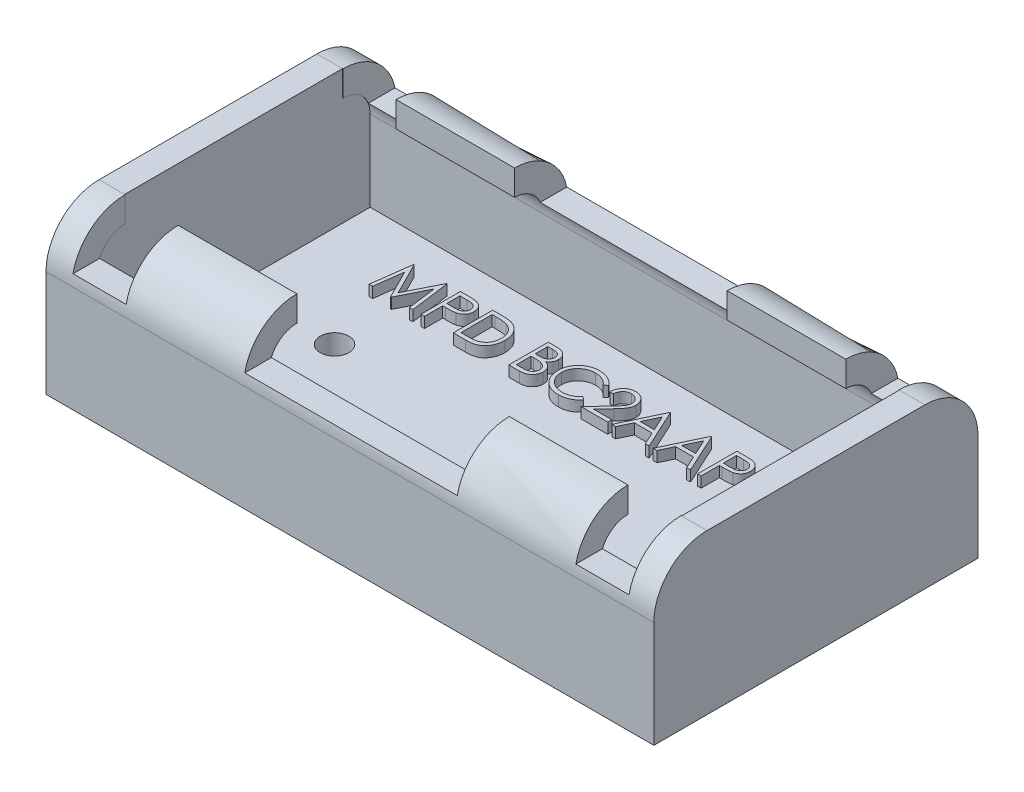
from build123d import *

# Parameters (mm, degrees)
SKETCH1_W           = 57.2
SKETCH1_H           = 30.5
BOSS_EXTRUDE1_DEPTH = 7.5
FILLET5_R           = 5
SHELL6_START        = -26.2
SHELL6_DEPTH        = 52.4
SKETCH2_W           = 5
SKETCH2_H           = 4
SKETCH2_W_2         = 20
CUT_EXTRUDE3_DEPTH  = 43.478935957
SKETCH3_R           = 1.78
SKETCH3_R_2         = 1.35
CUT_EXTRUDE4_DEPTH  = 35.774739395
BOSS_EXTRUDE2_DEPTH = 1
BOSS_EXTRUDE3_DEPTH = 1


# Read off the part's stored shape, not the designer's step: Shell6
with BuildPart() as part:
    # Sketch1 → Boss-Extrude1 (new, symmetric)
    with BuildSketch(Plane(origin=(0, 0, 0), x_dir=(1, 0, 0), z_dir=(0, 1, 0))):
        Rectangle(SKETCH1_W, SKETCH1_H)
    extrude(amount=BOSS_EXTRUDE1_DEPTH, both=True)

    # Fillet5
    fillet5_edges = [part.edges().sort_by_distance(p)[0] for p in [
        (0, 7.5, 15.25),
        (0, 7.5, -15.25),
    ]]
    fillet(fillet5_edges, radius=FILLET5_R)

    # Shell6 outline → Shell6 (cut)
    with BuildSketch(Plane.YZ.offset(SHELL6_START)):
        with BuildLine():
            Line((7.5, -10.25), (7.5, 10.25))
            Line((7.5, 10.25), (5.1, 10.25))
            ThreePointArc((5.1, 10.25), (4.338477631, 12.088477631), (2.5, 12.85))
            Line((2.5, 12.85), (-5.1, 12.85))
            Line((-5.1, 12.85), (-5.1, -12.85))
            Line((-5.1, -12.85), (2.5, -12.85))
            ThreePointArc((2.5, -12.85), (4.338477631, -12.088477631), (5.1, -10.25))
            Line((5.1, -10.25), (7.5, -10.25))
        make_face()
    extrude(amount=SHELL6_DEPTH, mode=Mode.SUBTRACT)

    # Sketch2 → Cut-Extrude3 (cut, through all)
    with BuildSketch(Plane.XY.offset(15.25)):
        with Locations((-23.66, 5.5)):
            Rectangle(SKETCH2_W, SKETCH2_H)
        with Locations((23.66, 5.5)):
            Rectangle(SKETCH2_W, SKETCH2_H)
        with Locations((0, 5.5)):
            Rectangle(SKETCH2_W_2, SKETCH2_H)
    extrude(amount=-CUT_EXTRUDE3_DEPTH, mode=Mode.SUBTRACT)

    # Sketch3 → Cut-Extrude4 (cut, through all)
    with BuildSketch(Plane(origin=(0, -5.1, 0), x_dir=(1, 0, 0), z_dir=(0, 1, 0))):
        with Locations(Location((0, 0, 0), (0, 0, 270))):
            Circle(SKETCH3_R)
        with Locations(Location((16, 0, 0), (0, 0, 270))):
            Circle(SKETCH3_R_2)
        with Locations(Location((-16.7, 0, 0), (0, 0, 270))):
            Circle(SKETCH3_R_2)
    extrude(amount=-CUT_EXTRUDE4_DEPTH, mode=Mode.SUBTRACT)

    # Sketch4 → Boss-Extrude2 (add)
    with BuildSketch(Plane(origin=(0, -5.1, 0), x_dir=(1, 0, 0), z_dir=(0, 1, 0))):
        Polygon((19.403576498, -7.630601638), (19.403576498, -5.75816574), (19.973448293, -5.75816574), (19.973448293, -7.630601638), (21.84588419, -7.630601638), (21.84588419, -8.200473433), (19.973448293, -8.200473433), (19.973448293, -10.07290933), (19.403576498, -10.07290933), (19.403576498, -8.200473433), (17.531140601, -8.200473433), (17.531140601, -7.630601638), align=None)
    extrude(amount=BOSS_EXTRUDE2_DEPTH)

    # Sketch5 → Boss-Extrude3 (add)
    # profile 1 of 10: a face of its own
    with BuildSketch(Plane(origin=(0, -5.1, 0), x_dir=(1, 0, 0), z_dir=(0, 1, 0))):
        Polygon((-18.979934346, 5.52880894), (-18.490942793, 9.232975607), (-18.443453477, 9.232975607), (-16.91414909, 6.193659367), (-15.388554806, 9.232975607), (-15.340323469, 9.232975607), (-14.848363833, 5.52880894), (-15.182273088, 5.52880894), (-15.536958919, 8.194146814), (-16.874079979, 5.52880894), (-16.949024056, 5.52880894), (-18.291339261, 8.200082979), (-18.645283071, 5.52880894), align=None)
    # profile 2 of 10: a face of its own
    with BuildSketch(Plane(origin=(0, -5.1, 0), x_dir=(1, 0, 0), z_dir=(0, 1, 0))):
        with BuildLine():
            Line((-14.088534774, 9.232975607), (-13.362096639, 9.232975607))
            add(Edge.make_bspline(
                [(-13.362096639, 9.232975607), (-13.312131763, 9.232920683), (-13.216396843, 9.232815447), (-13.079115075, 9.229624841), (-12.954433109, 9.225363259), (-12.84261979, 9.219455755), (-12.743331086, 9.212474364), (-12.657016277, 9.202682622), (-12.582996913, 9.192458809), (-12.538645921, 9.182064488), (-12.518419255, 9.177324064)],
                knots=[0, 0, 0, 0, 1.415646017, 2.712440637, 3.8905458, 4.950247383, 5.884950622, 6.709939814, 7.411656543, 8, 8, 8, 8], degree=3))
            add(Edge.make_bspline(
                [(-12.518419255, 9.177324064), (-12.492814432, 9.170315834), (-12.442208131, 9.156464514), (-12.369287861, 9.128721656), (-12.299910041, 9.095826365), (-12.233836641, 9.058336029), (-12.171879604, 9.01464214), (-12.113114543, 8.966515894), (-12.058060064, 8.912846151), (-12.007025758, 8.854234868), (-11.96015768, 8.791665979), (-11.919803766, 8.724205453), (-11.886014118, 8.652988823), (-11.857033489, 8.578065627), (-11.836175374, 8.498806701), (-11.820462406, 8.415762764), (-11.810489066, 8.328942717), (-11.809533855, 8.26961269), (-11.809047594, 8.239410069)],
                knots=[0, 0, 0, 0, 0.999701418, 1.975846123, 2.934577507, 3.890451536, 4.834027766, 5.787354733, 6.749476667, 7.726910423, 8.712836071, 9.690891519, 10.682875813, 11.679750201, 12.712814741, 13.765529915, 14.8625177, 16, 16, 16, 16], degree=3))
            add(Edge.make_bspline(
                [(-11.809047594, 8.239410069), (-11.809493602, 8.208953588), (-11.810366246, 8.149363427), (-11.820839815, 8.06218556), (-11.834947601, 7.978875263), (-11.856640315, 7.899617262), (-11.885051985, 7.824882238), (-11.918381075, 7.753528101), (-11.958580311, 7.686768781), (-12.004771089, 7.624361915), (-12.05615486, 7.566248925), (-12.112514219, 7.512850934), (-12.173621637, 7.464480509), (-12.239282911, 7.421029212), (-12.310138167, 7.383504649), (-12.38511278, 7.349894835), (-12.464858426, 7.321667963), (-12.520042586, 7.306819481), (-12.548100078, 7.299270011)],
                knots=[0, 0, 0, 0, 1.121902311, 2.195077645, 3.232258892, 4.234102512, 5.217864754, 6.176164875, 7.132989551, 8.084763148, 9.034132444, 9.988522005, 10.94243251, 11.903244335, 12.886203696, 13.894208494, 14.929344452, 16, 16, 16, 16], degree=3))
            add(Edge.make_bspline(
                [(-12.548100078, 7.299270011), (-12.571306506, 7.294335023), (-12.622164744, 7.283519709), (-12.705924125, 7.271445759), (-12.803444658, 7.261140131), (-12.914593238, 7.253413094), (-13.039270095, 7.246798121), (-13.177542676, 7.241540222), (-13.329682408, 7.238651126), (-13.435802808, 7.23850212), (-13.491208218, 7.238424325)],
                knots=[0, 0, 0, 0, 0.601384939, 1.31797006, 2.144135048, 3.087295005, 4.142315834, 5.309527816, 6.595305764, 8, 8, 8, 8], degree=3))
            Line((-13.491208218, 7.238424325), (-13.75610956, 7.238424325))
            Line((-13.75610956, 7.238424325), (-13.75610956, 5.52880894))
            Line((-13.75610956, 5.52880894), (-14.088534774, 5.52880894))
            Line((-14.088534774, 5.52880894), (-14.088534774, 9.232975607))
        make_face()
        with BuildLine():
            Line((-13.75610956, 8.853061077), (-13.75610956, 7.618338855))
            Line((-13.75610956, 7.618338855), (-13.107583585, 7.610176628))
            add(Edge.make_bspline(
                [(-13.107583585, 7.610176628), (-13.07591833, 7.610160263), (-13.014789209, 7.610128669), (-12.926485872, 7.614346364), (-12.844561043, 7.619215261), (-12.769266368, 7.626344113), (-12.700567904, 7.636420778), (-12.638351102, 7.6465932), (-12.583098394, 7.661309709), (-12.518435073, 7.681124957), (-12.446380197, 7.714920309), (-12.367992041, 7.763973942), (-12.301559837, 7.826501025), (-12.244072973, 7.896803813), (-12.198452586, 7.975013725), (-12.165055827, 8.058695017), (-12.145433102, 8.146989491), (-12.142801881, 8.207407771), (-12.141472808, 8.237926027)],
                knots=[0, 0, 0, 0, 1.160613943, 2.240541288, 3.23993089, 4.169200891, 5.011653406, 5.7853311, 6.478053781, 7.106038997, 8.262395093, 9.384106736, 10.481365981, 11.59014053, 12.70357646, 13.786202915, 14.881775077, 16, 16, 16, 16], degree=3))
            add(Edge.make_bspline(
                [(-12.141472808, 8.237926027), (-12.142809109, 8.267705954), (-12.145465509, 8.326904763), (-12.165209631, 8.413665618), (-12.198387655, 8.496465072), (-12.244379218, 8.57369492), (-12.300196913, 8.643744738), (-12.365072052, 8.704595864), (-12.43885192, 8.753513833), (-12.507482964, 8.785087389), (-12.568444219, 8.804365222), (-12.62139471, 8.817853512), (-12.681180674, 8.828622695), (-12.747821574, 8.837342835), (-12.82080089, 8.844807749), (-12.900745607, 8.849872908), (-12.987352879, 8.852837782), (-13.0474774, 8.852984843), (-13.078644783, 8.853061077)],
                knots=[0, 0, 0, 0, 1.120700087, 2.227813068, 3.331159281, 4.466773991, 5.599788987, 6.693661531, 7.80175334, 8.91857717, 9.525282508, 10.207424825, 10.974604443, 11.810962634, 12.737642355, 13.736264703, 14.826523623, 16, 16, 16, 16], degree=3))
            Line((-13.078644783, 8.853061077), (-13.75610956, 8.853061077))
        make_face(mode=Mode.SUBTRACT)
    # profile 3 of 10: a face of its own
    with BuildSketch(Plane(origin=(0, -5.1, 0), x_dir=(1, 0, 0), z_dir=(0, 1, 0))):
        with BuildLine():
            Line((-11.049218534, 5.52880894), (-11.049218534, 9.232975607))
            Line((-11.049218534, 9.232975607), (-10.301261803, 9.232975607))
            add(Edge.make_bspline(
                [(-10.301261803, 9.232975607), (-10.236207124, 9.23250722), (-10.110521823, 9.2316023), (-9.928898649, 9.225864661), (-9.7608525, 9.215714751), (-9.606936058, 9.200930336), (-9.466726775, 9.182776709), (-9.340617248, 9.160022114), (-9.227955397, 9.133152967), (-9.158666906, 9.110244866), (-9.125901226, 9.099411905)],
                knots=[0, 0, 0, 0, 1.314313732, 2.53924729, 3.670748893, 4.714932338, 5.66265055, 6.526160246, 7.303039223, 8, 8, 8, 8], degree=3))
            add(Edge.make_bspline(
                [(-9.125901226, 9.099411905), (-9.083044294, 9.083081075), (-8.998302282, 9.050789743), (-8.877644744, 8.989875991), (-8.764058735, 8.920858792), (-8.65693514, 8.84364717), (-8.558720932, 8.756054902), (-8.465579241, 8.661802819), (-8.381320325, 8.557463493), (-8.304159045, 8.445200797), (-8.234588806, 8.326337208), (-8.17411653, 8.201099218), (-8.123894387, 8.07012284), (-8.082203223, 7.933772308), (-8.049345722, 7.791747808), (-8.026928177, 7.643883967), (-8.012142213, 7.490765158), (-8.010656259, 7.386863851), (-8.009902295, 7.334144978)],
                knots=[0, 0, 0, 0, 0.984719456, 1.947108742, 2.898477687, 3.838006223, 4.779231079, 5.722358779, 6.681677486, 7.655904652, 8.64651281, 9.637519902, 10.640069247, 11.656948941, 12.698408672, 13.768548281, 14.867775369, 16, 16, 16, 16], degree=3))
            add(Edge.make_bspline(
                [(-8.009902295, 7.334144978), (-8.010567952, 7.288360167), (-8.011879699, 7.198136415), (-8.023658225, 7.065166468), (-8.040778164, 6.936141271), (-8.067283273, 6.811675239), (-8.099459267, 6.690677875), (-8.140696327, 6.574438749), (-8.18793556, 6.461891551), (-8.243021682, 6.354558056), (-8.303496314, 6.25286982), (-8.368395159, 6.15701072), (-8.437648995, 6.06834861), (-8.511918207, 5.986614995), (-8.59024304, 5.911933092), (-8.67313629, 5.843679042), (-8.760811852, 5.783188355), (-8.852877033, 5.728083999), (-8.952017603, 5.680014122), (-9.060111395, 5.639342362), (-9.177619392, 5.605638027), (-9.304253163, 5.577517163), (-9.44023151, 5.555210351), (-9.585687749, 5.540259919), (-9.740398397, 5.530149732), (-9.84663312, 5.529264549), (-9.901312718, 5.52880894)],
                knots=[0, 0, 0, 0, 1.105936401, 2.179363191, 3.223086493, 4.248585256, 5.251745608, 6.245858792, 7.225916811, 8.198733463, 9.158002045, 10.082870192, 10.993790845, 11.873723703, 12.748670949, 13.606408763, 14.465103618, 15.319838547, 16.196477973, 17.123216899, 18.106603292, 19.147568657, 20.255746949, 21.433717677, 22.679120308, 24, 24, 24, 24], degree=3))
            Line((-9.901312718, 5.52880894), (-11.049218534, 5.52880894))
        make_face()
        with BuildLine():
            Line((-10.716793321, 5.90872347), (-10.291615536, 5.90872347))
            add(Edge.make_bspline(
                [(-10.291615536, 5.90872347), (-10.230519677, 5.908986039), (-10.113009965, 5.909491054), (-9.944038585, 5.913922511), (-9.789649557, 5.921163562), (-9.64982096, 5.931297186), (-9.524631742, 5.944704803), (-9.413820274, 5.959653659), (-9.317749792, 5.978277627), (-9.259616138, 5.995159059), (-9.232752188, 6.002960082)],
                knots=[0, 0, 0, 0, 1.375205317, 2.645023457, 3.804390687, 4.853969522, 5.800190428, 6.637939096, 7.370582563, 8, 8, 8, 8], degree=3))
            add(Edge.make_bspline(
                [(-9.232752188, 6.002960082), (-9.198940172, 6.014867981), (-9.132123738, 6.038399359), (-9.035941256, 6.081322884), (-8.946240093, 6.132167408), (-8.861456983, 6.188684815), (-8.782794606, 6.2528685), (-8.709320749, 6.323322797), (-8.641183343, 6.400406267), (-8.579086367, 6.484023238), (-8.523515078, 6.573653272), (-8.475391361, 6.668415204), (-8.433215156, 6.767270745), (-8.400111979, 6.871737938), (-8.374166319, 6.980882858), (-8.355788691, 7.094713183), (-8.344343108, 7.213207657), (-8.343008075, 7.293801988), (-8.342327509, 7.334886998)],
                knots=[0, 0, 0, 0, 0.998632004, 1.973411704, 2.929992603, 3.868527914, 4.809262121, 5.754881198, 6.702106254, 7.672490631, 8.653608572, 9.636854334, 10.631411391, 11.644891563, 12.686317036, 13.754757253, 14.855430412, 16, 16, 16, 16], degree=3))
            add(Edge.make_bspline(
                [(-8.342327509, 7.334886998), (-8.342870738, 7.378208265), (-8.343937916, 7.463313277), (-8.357351561, 7.588186763), (-8.376953541, 7.708287118), (-8.405299609, 7.823622374), (-8.441421455, 7.934417547), (-8.486500785, 8.040059862), (-8.53800629, 8.141665015), (-8.599287321, 8.236887885), (-8.666402158, 8.326944759), (-8.740885413, 8.409447045), (-8.821553737, 8.484582679), (-8.907527286, 8.553521785), (-9.00122905, 8.613490842), (-9.100451706, 8.667134246), (-9.206650875, 8.712659398), (-9.280535978, 8.736872861), (-9.318084553, 8.749178198)],
                knots=[0, 0, 0, 0, 1.122418816, 2.205001699, 3.251619955, 4.274784885, 5.280384055, 6.268708349, 7.249350384, 8.229342522, 9.199999885, 10.157847722, 11.105861043, 12.055065948, 13.010012805, 13.98527497, 14.976112212, 16, 16, 16, 16], degree=3))
            add(Edge.make_bspline(
                [(-9.318084553, 8.749178198), (-9.34914785, 8.757768084), (-9.415196941, 8.776032539), (-9.522977041, 8.795956058), (-9.644278074, 8.813529153), (-9.779638591, 8.828407244), (-9.928904293, 8.839082993), (-10.09218998, 8.847095967), (-10.269566228, 8.852500487), (-10.392526076, 8.852869535), (-10.456344102, 8.853061077)],
                knots=[0, 0, 0, 0, 0.674548936, 1.434276114, 2.292660221, 3.240891867, 4.284742987, 5.42552168, 6.663806718, 8, 8, 8, 8], degree=3))
            Line((-10.456344102, 8.853061077), (-10.716793321, 8.853061077))
            Line((-10.716793321, 8.853061077), (-10.716793321, 5.90872347))
        make_face(mode=Mode.SUBTRACT)
    # profile 4 of 10: a face of its own
    with BuildSketch(Plane(origin=(0, -5.1, 0), x_dir=(1, 0, 0), z_dir=(0, 1, 0))):
        with BuildLine():
            Line((-5.825393748, 9.232975607), (-5.102665716, 9.232975607))
            add(Edge.make_bspline(
                [(-5.102665716, 9.232975607), (-5.067287244, 9.232789604), (-4.998714958, 9.232429085), (-4.898999383, 9.226837771), (-4.805602725, 9.219213887), (-4.718497899, 9.207117039), (-4.637725156, 9.192520742), (-4.563041073, 9.174844653), (-4.49468314, 9.15364982), (-4.413072161, 9.119945839), (-4.320022795, 9.069862153), (-4.219271163, 8.995854421), (-4.133118343, 8.905332565), (-4.058837824, 8.803221754), (-3.999781639, 8.690894729), (-3.957057466, 8.571028754), (-3.930008714, 8.445169911), (-3.927226955, 8.358764214), (-3.925821098, 8.315096166)],
                knots=[0, 0, 0, 0, 1.001505555, 1.941167018, 2.826882275, 3.653841531, 4.429895133, 5.150066043, 5.825578002, 6.45369114, 7.647487171, 8.808567382, 9.977351308, 11.170798116, 12.373658725, 13.556498008, 14.765093433, 16, 16, 16, 16], degree=3))
            add(Edge.make_bspline(
                [(-3.925821098, 8.315096166), (-3.926978088, 8.274188878), (-3.929251681, 8.193802199), (-3.950992768, 8.0762276), (-3.985029476, 7.96430756), (-4.032342531, 7.858450536), (-4.09383381, 7.761048295), (-4.166708864, 7.671315105), (-4.254631814, 7.593050237), (-4.320505909, 7.549295665), (-4.353966965, 7.527070325)],
                knots=[0, 0, 0, 0, 1.044552857, 2.05264487, 3.044412934, 4.028983338, 5.005914585, 5.980388656, 6.974128949, 8, 8, 8, 8], degree=3))
            add(Edge.make_bspline(
                [(-4.353966965, 7.527070325), (-4.311887179, 7.510914868), (-4.231378125, 7.480005476), (-4.120585428, 7.425357943), (-4.025129217, 7.36591971), (-3.944275571, 7.301010168), (-3.875126553, 7.23104501), (-3.814745523, 7.154998348), (-3.763224402, 7.071878162), (-3.719078225, 6.982551087), (-3.684630791, 6.887929242), (-3.658832959, 6.78890017), (-3.644050742, 6.685818974), (-3.641947155, 6.615666948), (-3.640885201, 6.580252082)],
                knots=[0, 0, 0, 0, 1.27268992, 2.434971085, 3.483601985, 4.442670788, 5.356604649, 6.2567628, 7.179492994, 8.113709626, 9.066344395, 10.018646069, 10.999752585, 12, 12, 12, 12], degree=3))
            add(Edge.make_bspline(
                [(-3.640885201, 6.580252082), (-3.64191903, 6.544092143), (-3.643953117, 6.472946448), (-3.658960253, 6.368430598), (-3.684369892, 6.268550446), (-3.719370188, 6.172659961), (-3.765050304, 6.080944652), (-3.8206424, 5.993300614), (-3.886927471, 5.910608448), (-3.961077341, 5.83194928), (-4.044963112, 5.761223205), (-4.135467286, 5.698235749), (-4.233729641, 5.6464345), (-4.338136335, 5.602920043), (-4.449858569, 5.569680758), (-4.568394662, 5.546426451), (-4.693642381, 5.530757787), (-4.779589368, 5.529469578), (-4.823665983, 5.52880894)],
                knots=[0, 0, 0, 0, 0.978564426, 1.925352924, 2.850884081, 3.763762016, 4.682927383, 5.618979971, 6.567305752, 7.547517671, 8.540179244, 9.531824382, 10.526200242, 11.540722885, 12.589160233, 13.674978461, 14.80764778, 16, 16, 16, 16], degree=3))
            Line((-4.823665983, 5.52880894), (-5.825393748, 5.52880894))
            Line((-5.825393748, 5.52880894), (-5.825393748, 9.232975607))
        make_face()
        with BuildLine():
            Line((-5.492968534, 8.853061077), (-5.492968534, 7.665828171))
            Line((-5.492968534, 7.665828171), (-5.269620344, 7.665828171))
            add(Edge.make_bspline(
                [(-5.269620344, 7.665828171), (-5.236972035, 7.666251423), (-5.17388885, 7.667069232), (-5.082533626, 7.66941187), (-4.997734649, 7.675971466), (-4.919638292, 7.682529177), (-4.848367539, 7.693191449), (-4.784080285, 7.705883112), (-4.725767604, 7.719305854), (-4.658521585, 7.742133561), (-4.582244381, 7.775870767), (-4.500929346, 7.82822846), (-4.429243699, 7.890590067), (-4.368710008, 7.962547168), (-4.319167869, 8.041780548), (-4.28475752, 8.127025997), (-4.261424144, 8.21615897), (-4.25931644, 8.277349954), (-4.258246312, 8.308417981)],
                knots=[0, 0, 0, 0, 1.156816544, 2.235205308, 3.236616184, 4.169592532, 5.011045266, 5.787822928, 6.49130361, 7.128639758, 8.301311294, 9.436451833, 10.541879658, 11.654887649, 12.756523258, 13.837046038, 14.901820046, 16, 16, 16, 16], degree=3))
            add(Edge.make_bspline(
                [(-4.258246312, 8.308417981), (-4.258803186, 8.328976923), (-4.259895555, 8.369305532), (-4.268841967, 8.428095265), (-4.28404765, 8.483386569), (-4.303578444, 8.53593717), (-4.330871473, 8.584103878), (-4.363006138, 8.629552093), (-4.401831827, 8.670734085), (-4.446024983, 8.709225138), (-4.496834109, 8.743350596), (-4.554228892, 8.773238737), (-4.618985851, 8.797306059), (-4.690013622, 8.818383987), (-4.768405523, 8.833188265), (-4.853256926, 8.845521433), (-4.945262836, 8.851800252), (-5.008916403, 8.852631428), (-5.04182003, 8.853061077)],
                knots=[0, 0, 0, 0, 0.91205012, 1.789085906, 2.630437955, 3.453916878, 4.269457761, 5.079663411, 5.91843418, 6.774407191, 7.675494373, 8.627863946, 9.638891023, 10.736472738, 11.911756761, 13.175263542, 14.539845004, 16, 16, 16, 16], degree=3))
            Line((-5.04182003, 8.853061077), (-5.492968534, 8.853061077))
        make_face(mode=Mode.SUBTRACT)
        with BuildLine():
            Line((-5.492968534, 7.285913641), (-5.492968534, 5.90872347))
            Line((-5.492968534, 5.90872347), (-5.019559413, 5.90872347))
            add(Edge.make_bspline(
                [(-5.019559413, 5.90872347), (-4.985672716, 5.909129603), (-4.920360576, 5.90991237), (-4.826061774, 5.912467773), (-4.738661323, 5.918280432), (-4.658558046, 5.927430623), (-4.584886983, 5.937356148), (-4.518531914, 5.950703087), (-4.458954951, 5.965994904), (-4.389872975, 5.989631903), (-4.312081763, 6.026352334), (-4.228250273, 6.081718224), (-4.153715859, 6.147677058), (-4.090421959, 6.224015609), (-4.03854988, 6.307022096), (-4.000814523, 6.395017592), (-3.977540866, 6.486548108), (-3.974723404, 6.548954546), (-3.973310415, 6.580252082)],
                knots=[0, 0, 0, 0, 1.160039823, 2.235823828, 3.228722157, 4.157150951, 4.99529583, 5.772374946, 6.472645482, 7.099169577, 8.269452708, 9.405989375, 10.527446681, 11.663510218, 12.788923519, 13.866172445, 14.929861265, 16, 16, 16, 16], degree=3))
            add(Edge.make_bspline(
                [(-3.973310415, 6.580252082), (-3.973602625, 6.599824201), (-3.974182332, 6.638652739), (-3.982924817, 6.695713647), (-3.995639495, 6.75098603), (-4.01207693, 6.804619972), (-4.036015866, 6.855645795), (-4.063962792, 6.905072671), (-4.096730276, 6.952965936), (-4.147788685, 7.013515571), (-4.222054035, 7.083277743), (-4.327577039, 7.151579933), (-4.447562721, 7.206663862), (-4.534586818, 7.230052475), (-4.579541217, 7.242134428)],
                knots=[0, 0, 0, 0, 0.723448775, 1.435228256, 2.130040452, 2.821711965, 3.505591119, 4.210454504, 4.921174351, 5.648778258, 7.137944449, 8.670945889, 10.280296675, 12, 12, 12, 12], degree=3))
            add(Edge.make_bspline(
                [(-4.579541217, 7.242134428), (-4.597563677, 7.245791058), (-4.636640087, 7.253719387), (-4.700359776, 7.262088373), (-4.773105238, 7.269544395), (-4.855044449, 7.275059537), (-4.946281081, 7.280760296), (-5.047009987, 7.282977315), (-5.156819812, 7.285622365), (-5.233011739, 7.285814065), (-5.272588426, 7.285913641)],
                knots=[0, 0, 0, 0, 0.634451884, 1.375622551, 2.216452059, 3.157844607, 4.20941857, 5.370758133, 6.634282058, 8, 8, 8, 8], degree=3))
            Line((-5.272588426, 7.285913641), (-5.492968534, 7.285913641))
        make_face(mode=Mode.SUBTRACT)
    # profile 5 of 10: a face of its own
    with BuildSketch(Plane(origin=(0, -5.1, 0), x_dir=(1, 0, 0), z_dir=(0, 1, 0))):
        with BuildLine():
            Line((0.538174628, 8.553284768), (0.247302566, 8.330678598))
            add(Edge.make_bspline(
                [(0.247302566, 8.330678598), (0.226553001, 8.355407583), (0.18533362, 8.404532152), (0.119019297, 8.473513837), (0.049908392, 8.538141238), (-0.021972678, 8.598722228), (-0.097917746, 8.653138305), (-0.176087092, 8.704225222), (-0.257788356, 8.750016911), (-0.370767275, 8.805540238), (-0.518561248, 8.863479919), (-0.704610786, 8.912060839), (-0.898826699, 8.942986583), (-1.031327492, 8.94633604), (-1.098722741, 8.948039709)],
                knots=[0, 0, 0, 0, 0.757959112, 1.505699292, 2.245454638, 2.979532153, 3.711538275, 4.438200793, 5.171680507, 5.909471876, 7.393775596, 8.890124382, 10.418191784, 12, 12, 12, 12], degree=3))
            add(Edge.make_bspline(
                [(-1.098722741, 8.948039709), (-1.135852566, 8.947612182), (-1.209767617, 8.946761096), (-1.319462251, 8.935533105), (-1.427108563, 8.919752075), (-1.532636532, 8.896336108), (-1.63591183, 8.866731752), (-1.737609622, 8.831356523), (-1.836257507, 8.787589317), (-1.933220142, 8.739214742), (-2.026119807, 8.684575696), (-2.114019733, 8.624977399), (-2.196599332, 8.561086772), (-2.27392393, 8.492664351), (-2.346072575, 8.420018276), (-2.412522479, 8.342374348), (-2.473043705, 8.259980798), (-2.52883589, 8.173924108), (-2.578802699, 8.084454945), (-2.620638488, 7.991242162), (-2.657685576, 7.895881987), (-2.687000608, 7.797297008), (-2.710204055, 7.696180914), (-2.726214165, 7.59226233), (-2.737314464, 7.485758353), (-2.738161318, 7.413570164), (-2.738588192, 7.377182171)],
                knots=[0, 0, 0, 0, 1.054917814, 2.100044995, 3.131103042, 4.146048494, 5.169673617, 6.183595914, 7.203665975, 8.234915748, 9.262203917, 10.264457458, 11.251630812, 12.227803204, 13.197192746, 14.159520551, 15.12972552, 16.100847026, 17.073214652, 18.039054194, 19.002613845, 19.979014051, 20.95965708, 21.949030935, 22.966165397, 24, 24, 24, 24], degree=3))
            add(Edge.make_bspline(
                [(-2.738588192, 7.377182171), (-2.737252767, 7.32243319), (-2.734630837, 7.21494083), (-2.71129635, 7.057491934), (-2.675836795, 6.906657554), (-2.622691976, 6.763380554), (-2.557160981, 6.625894208), (-2.474356334, 6.496524755), (-2.378453832, 6.373317224), (-2.268096738, 6.259183438), (-2.147017249, 6.154923079), (-2.017109043, 6.063112047), (-1.878695672, 5.986578796), (-1.733305405, 5.922892586), (-1.579819434, 5.873937549), (-1.418513768, 5.839473852), (-1.24973924, 5.816992544), (-1.134413292, 5.814840224), (-1.075720103, 5.813744838)],
                knots=[0, 0, 0, 0, 1.029171465, 2.020641659, 2.987623507, 3.938342917, 4.889210282, 5.84687017, 6.821220943, 7.821438502, 8.827599549, 9.822697543, 10.807740252, 11.797342354, 12.80366471, 13.83203677, 14.896651826, 16, 16, 16, 16], degree=3))
            add(Edge.make_bspline(
                [(-1.075720103, 5.813744838), (-1.011053091, 5.815532129), (-0.883772941, 5.819049947), (-0.697116779, 5.848851819), (-0.518432261, 5.897173116), (-0.347709773, 5.964798417), (-0.185430606, 6.05270918), (-0.031340807, 6.1592811), (0.114689688, 6.285527919), (0.202500962, 6.38192423), (0.247302566, 6.431105949)],
                knots=[0, 0, 0, 0, 1.028121516, 2.023589091, 2.998037872, 3.967518031, 4.937445131, 5.927275754, 6.942489185, 8, 8, 8, 8], degree=3))
            Line((0.247302566, 6.431105949), (0.538174628, 6.21072584))
            add(Edge.make_bspline(
                [(0.538174628, 6.21072584), (0.514766295, 6.180522645), (0.468061754, 6.120260927), (0.392435353, 6.035306701), (0.31276688, 5.955398263), (0.228464586, 5.881179864), (0.140498257, 5.811166388), (0.047288393, 5.74734695), (-0.049939666, 5.688830764), (-0.15085649, 5.635250603), (-0.255354855, 5.587713183), (-0.363309549, 5.547016279), (-0.474255241, 5.511959104), (-0.588197004, 5.483117471), (-0.70537118, 5.460605574), (-0.825354932, 5.445556418), (-0.948407216, 5.435246225), (-1.031424387, 5.434306514), (-1.073494042, 5.433830308)],
                knots=[0, 0, 0, 0, 0.986787822, 1.968848986, 2.935600012, 3.899624008, 4.868462664, 5.837806735, 6.815139263, 7.798259679, 8.787526145, 9.778297419, 10.776456485, 11.791383307, 12.812564526, 13.85620153, 14.913611965, 16, 16, 16, 16], degree=3))
            add(Edge.make_bspline(
                [(-1.073494042, 5.433830308), (-1.113333589, 5.434107583), (-1.192111361, 5.434655861), (-1.308420873, 5.443537571), (-1.421651513, 5.45565521), (-1.531479659, 5.473901015), (-1.638504649, 5.495432108), (-1.741756268, 5.524294188), (-1.842250532, 5.55662539), (-1.939583693, 5.594624834), (-2.033838541, 5.63750446), (-2.124711075, 5.685967193), (-2.212159499, 5.7396055), (-2.29704357, 5.797237053), (-2.378109346, 5.860713031), (-2.456059327, 5.929151886), (-2.531330614, 6.002322947), (-2.577900123, 6.055086), (-2.601314388, 6.081614262)],
                knots=[0, 0, 0, 0, 1.114604814, 2.203992996, 3.262667896, 4.300477797, 5.318619304, 6.316056647, 7.298880507, 8.271930387, 9.238335007, 10.195173496, 11.151986948, 12.108099108, 13.064862484, 14.031167946, 15.010108607, 16, 16, 16, 16], degree=3))
            add(Edge.make_bspline(
                [(-2.601314388, 6.081614262), (-2.63881711, 6.127695354), (-2.71336979, 6.219301205), (-2.808752805, 6.367770536), (-2.890400634, 6.522782723), (-2.95641515, 6.685152148), (-3.008022376, 6.854514466), (-3.043774141, 7.030955052), (-3.067006256, 7.214309124), (-3.069662978, 7.339019726), (-3.071013406, 7.40241087)],
                knots=[0, 0, 0, 0, 0.994628077, 1.977248131, 2.950237994, 3.925870899, 4.908910175, 5.911660606, 6.938484602, 8, 8, 8, 8], degree=3))
            add(Edge.make_bspline(
                [(-3.071013406, 7.40241087), (-3.069367493, 7.469038725), (-3.066129261, 7.60012487), (-3.038617044, 7.792502304), (-2.994358819, 7.976812534), (-2.931497111, 8.152711497), (-2.851798948, 8.321124377), (-2.753345782, 8.480764652), (-2.637281389, 8.632653265), (-2.504516047, 8.774485544), (-2.35892395, 8.904173025), (-2.203011539, 9.018267924), (-2.037083979, 9.113218962), (-1.862969252, 9.192589901), (-1.679363573, 9.253596957), (-1.486658674, 9.29630408), (-1.285216655, 9.322886361), (-1.147778922, 9.32624679), (-1.077946165, 9.327954239)],
                knots=[0, 0, 0, 0, 1.032925535, 2.032216505, 3.007276963, 3.968222605, 4.92396291, 5.891752235, 6.871517503, 7.883894988, 8.900124299, 9.891468569, 10.874487609, 11.85992873, 12.854644235, 13.869047385, 14.917252991, 16, 16, 16, 16], degree=3))
            add(Edge.make_bspline(
                [(-1.077946165, 9.327954239), (-1.035385849, 9.327443976), (-0.951141989, 9.326433962), (-0.826520432, 9.316584962), (-0.705190636, 9.300166395), (-0.587069013, 9.277818555), (-0.471580911, 9.250082473), (-0.35960899, 9.213950657), (-0.250496213, 9.172636995), (-0.144930735, 9.125055952), (-0.043419053, 9.071645317), (0.054007218, 9.012997115), (0.146574193, 8.949184055), (0.234933224, 8.880748861), (0.317606214, 8.806243719), (0.396940446, 8.72771793), (0.470241754, 8.642909632), (0.515488885, 8.583214411), (0.538174628, 8.553284768)],
                knots=[0, 0, 0, 0, 1.096760587, 2.17092713, 3.219439832, 4.250915756, 5.268269357, 6.278326846, 7.281116186, 8.274029601, 9.260640565, 10.235837813, 11.203064059, 12.156899882, 13.114053108, 14.069676657, 15.032185724, 16, 16, 16, 16], degree=3))
        make_face()
    # profile 6 of 10: a face of its own
    with BuildSketch(Plane(origin=(0, -5.1, 0), x_dir=(1, 0, 0), z_dir=(0, 1, 0))):
        with BuildLine():
            Line((1.440471637, 8.093232017), (1.108046423, 8.093232017))
            add(Edge.make_bspline(
                [(1.108046423, 8.093232017), (1.110212993, 8.137333707), (1.11446808, 8.223948251), (1.134394686, 8.350232719), (1.162907114, 8.470940714), (1.20322057, 8.58510304), (1.25328638, 8.693729111), (1.313325659, 8.796387461), (1.384439151, 8.892686469), (1.465091278, 8.981733411), (1.552688088, 9.06342359), (1.64720354, 9.133967056), (1.746522861, 9.193569924), (1.850344725, 9.243397572), (1.959840488, 9.280798909), (2.074016512, 9.308550144), (2.193374432, 9.325246777), (2.274696788, 9.327041483), (2.316055905, 9.327954239)],
                knots=[0, 0, 0, 0, 1.10065271, 2.161652631, 3.183658789, 4.190468796, 5.17591951, 6.163126047, 7.15150782, 8.156236427, 9.156009102, 10.134482811, 11.092018607, 12.041330605, 13.001268258, 13.972401359, 14.968799086, 16, 16, 16, 16], degree=3))
            add(Edge.make_bspline(
                [(2.316055905, 9.327954239), (2.3566727, 9.327003373), (2.436483251, 9.325134954), (2.55296555, 9.309089532), (2.663854853, 9.283958781), (2.768934406, 9.248699965), (2.867365825, 9.201303113), (2.959888547, 9.144367384), (3.047604072, 9.078518063), (3.126562917, 9.00099111), (3.199067301, 8.91822692), (3.261617188, 8.829868889), (3.315182786, 8.738609561), (3.359831414, 8.643753048), (3.392699161, 8.544406209), (3.417652764, 8.44201542), (3.431757611, 8.335520828), (3.43392235, 8.26344139), (3.435022919, 8.226795719)],
                knots=[0, 0, 0, 0, 1.111607364, 2.184268762, 3.212621178, 4.221274766, 5.211760367, 6.196651075, 7.1921475, 8.207485113, 9.220403448, 10.201281604, 11.166441695, 12.114753415, 13.065576456, 14.026450734, 14.996634279, 16, 16, 16, 16], degree=3))
            add(Edge.make_bspline(
                [(3.435022919, 8.226795719), (3.433230882, 8.175204261), (3.429678257, 8.072926701), (3.399288875, 7.922627638), (3.351826317, 7.777007936), (3.294679115, 7.659810958), (3.237029112, 7.565372177), (3.185078166, 7.487617798), (3.124261241, 7.403897844), (3.053693164, 7.314492662), (2.974833708, 7.218701954), (2.886968585, 7.116583587), (2.789471233, 7.009192631), (2.721040986, 6.935844203), (2.685582147, 6.897836885)],
                knots=[0, 0, 0, 0, 1.184426356, 2.348067706, 3.509069118, 4.696110526, 5.333549288, 6.050745305, 6.844228056, 7.710549037, 8.667450064, 9.695053472, 10.805634456, 12, 12, 12, 12], degree=3))
            Line((2.685582147, 6.897836885), (1.75879846, 5.90872347))
            Line((1.75879846, 5.90872347), (3.482512235, 5.90872347))
            Line((3.482512235, 5.90872347), (3.482512235, 5.52880894))
            Line((3.482512235, 5.52880894), (0.965578474, 5.52880894))
            Line((0.965578474, 5.52880894), (2.402130291, 7.06182343))
            add(Edge.make_bspline(
                [(2.402130291, 7.06182343), (2.437105971, 7.098334138), (2.504287095, 7.168463735), (2.599306988, 7.270850035), (2.684649918, 7.365834965), (2.760868325, 7.453239062), (2.826308785, 7.534340805), (2.884381897, 7.606513533), (2.930912147, 7.67292866), (2.981410941, 7.749912476), (3.030320738, 7.843905512), (3.072349648, 7.958770333), (3.09797703, 8.077015008), (3.101051314, 8.156921331), (3.102597705, 8.197114896)],
                knots=[0, 0, 0, 0, 1.329631726, 2.553950428, 3.673215718, 4.687767853, 5.603093632, 6.413772471, 7.123043292, 7.734684054, 8.834405432, 9.900288307, 10.943827018, 12, 12, 12, 12], degree=3))
            add(Edge.make_bspline(
                [(3.102597705, 8.197114896), (3.101924878, 8.222389376), (3.100598865, 8.272200523), (3.088896135, 8.345231618), (3.071210849, 8.415679379), (3.045868784, 8.483760501), (3.012418318, 8.548790483), (2.971700657, 8.610848483), (2.924721174, 8.670844304), (2.870374413, 8.727098211), (2.810672222, 8.778619154), (2.747601641, 8.824258811), (2.680873614, 8.862400203), (2.610769485, 8.893667071), (2.537484696, 8.918194349), (2.460877507, 8.935189679), (2.38115959, 8.945860308), (2.326725807, 8.947304057), (2.298989432, 8.948039709)],
                knots=[0, 0, 0, 0, 0.991446411, 1.95395049, 2.89581595, 3.838931463, 4.798493298, 5.75982156, 6.748411868, 7.785213223, 8.824556874, 9.840280684, 10.836137867, 11.835679398, 12.848801643, 13.863922112, 14.911575587, 16, 16, 16, 16], degree=3))
            add(Edge.make_bspline(
                [(2.298989432, 8.948039709), (2.270021967, 8.947282967), (2.21313465, 8.94579685), (2.129612006, 8.935401197), (2.049934558, 8.917466849), (1.973901878, 8.892938202), (1.901385316, 8.861761238), (1.832737536, 8.822929141), (1.768112645, 8.776591611), (1.707389158, 8.724055356), (1.651441447, 8.665563811), (1.60228517, 8.600359933), (1.559333755, 8.529634252), (1.521858983, 8.453577603), (1.491425877, 8.371499852), (1.46817096, 8.283692365), (1.44976988, 8.190536403), (1.443622529, 8.126205521), (1.440471637, 8.093232017)],
                knots=[0, 0, 0, 0, 1.031018746, 2.02475058, 2.990194455, 3.934040569, 4.864654155, 5.795059489, 6.735614925, 7.690564532, 8.649604399, 9.611025574, 10.590972636, 11.591080095, 12.624614302, 13.701020113, 14.821632451, 16, 16, 16, 16], degree=3))
        make_face()
    # profile 7 of 10: a face of its own
    with BuildSketch(Plane(origin=(0, -5.1, 0), x_dir=(1, 0, 0), z_dir=(0, 1, 0))):
        Polygon((5.667020782, 9.232975607), (7.376636167, 5.52880894), (7.015272151, 5.52880894), (6.467660973, 6.716041846), (4.788468432, 6.716041846), (4.225274822, 5.52880894), (3.862426765, 5.52880894), (5.619531466, 9.232975607), align=None)
        Polygon((5.639566021, 8.510989596), (4.968779429, 7.095956376), (6.292544119, 7.095956376), align=None, mode=Mode.SUBTRACT)
    # profile 8 of 10: a face of its own
    with BuildSketch(Plane(origin=(0, -5.1, 0), x_dir=(1, 0, 0), z_dir=(0, 1, 0))):
        Polygon((9.561144714, 9.232975607), (11.270760098, 5.52880894), (10.909396083, 5.52880894), (10.361784905, 6.716041846), (8.682592363, 6.716041846), (8.119398753, 5.52880894), (7.756550697, 5.52880894), (9.513655397, 9.232975607), align=None)
        Polygon((9.533689953, 8.510989596), (8.862903361, 7.095956376), (10.186668051, 7.095956376), align=None, mode=Mode.SUBTRACT)
    # profile 9 of 10: a face of its own
    with BuildSketch(Plane(origin=(0, -5.1, 0), x_dir=(1, 0, 0), z_dir=(0, 1, 0))):
        with BuildLine():
            Line((11.935610526, 9.232975607), (12.66204866, 9.232975607))
            add(Edge.make_bspline(
                [(12.66204866, 9.232975607), (12.712013536, 9.232920683), (12.807748456, 9.232815447), (12.945030224, 9.229624841), (13.06971219, 9.225363259), (13.181525509, 9.219455755), (13.280814213, 9.212474364), (13.367129022, 9.202682622), (13.441148386, 9.192458809), (13.485499378, 9.182064488), (13.505726044, 9.177324064)],
                knots=[0, 0, 0, 0, 1.415646017, 2.712440637, 3.8905458, 4.950247383, 5.884950622, 6.709939814, 7.411656543, 8, 8, 8, 8], degree=3))
            add(Edge.make_bspline(
                [(13.505726044, 9.177324064), (13.531330867, 9.170315834), (13.581937168, 9.156464514), (13.654857439, 9.128721656), (13.724235258, 9.095826365), (13.790308658, 9.058336029), (13.852265696, 9.01464214), (13.911030756, 8.966515894), (13.966085235, 8.912846151), (14.017119541, 8.854234868), (14.063987619, 8.791665979), (14.104341533, 8.724205453), (14.138131181, 8.652988823), (14.16711181, 8.578065627), (14.187969925, 8.498806701), (14.203682894, 8.415762764), (14.213656233, 8.328942717), (14.214611444, 8.26961269), (14.215097705, 8.239410069)],
                knots=[0, 0, 0, 0, 0.999701418, 1.975846123, 2.934577507, 3.890451536, 4.834027766, 5.787354733, 6.749476667, 7.726910423, 8.712836071, 9.690891519, 10.682875813, 11.679750201, 12.712814741, 13.765529915, 14.8625177, 16, 16, 16, 16], degree=3))
            add(Edge.make_bspline(
                [(14.215097705, 8.239410069), (14.214651697, 8.208953588), (14.213779053, 8.149363427), (14.203305484, 8.06218556), (14.189197698, 7.978875263), (14.167504984, 7.899617262), (14.139093314, 7.824882238), (14.105764224, 7.753528101), (14.065564988, 7.686768781), (14.01937421, 7.624361915), (13.967990439, 7.566248925), (13.91163108, 7.512850934), (13.850523662, 7.464480509), (13.784862388, 7.421029212), (13.714007132, 7.383504649), (13.639032519, 7.349894835), (13.559286873, 7.321667963), (13.504102713, 7.306819481), (13.476045221, 7.299270011)],
                knots=[0, 0, 0, 0, 1.121902311, 2.195077645, 3.232258892, 4.234102512, 5.217864754, 6.176164875, 7.132989551, 8.084763148, 9.034132444, 9.988522005, 10.94243251, 11.903244335, 12.886203696, 13.894208494, 14.929344452, 16, 16, 16, 16], degree=3))
            add(Edge.make_bspline(
                [(13.476045221, 7.299270011), (13.452838793, 7.294335023), (13.401980555, 7.283519709), (13.318221174, 7.271445759), (13.220700641, 7.261140131), (13.109552061, 7.253413094), (12.984875204, 7.246798121), (12.846602623, 7.241540222), (12.694462891, 7.238651126), (12.588342491, 7.23850212), (12.532937081, 7.238424325)],
                knots=[0, 0, 0, 0, 0.601384939, 1.31797006, 2.144135048, 3.087295005, 4.142315834, 5.309527816, 6.595305764, 8, 8, 8, 8], degree=3))
            Line((12.532937081, 7.238424325), (12.268035739, 7.238424325))
            Line((12.268035739, 7.238424325), (12.268035739, 5.52880894))
            Line((12.268035739, 5.52880894), (11.935610526, 5.52880894))
            Line((11.935610526, 5.52880894), (11.935610526, 9.232975607))
        make_face()
        with BuildLine():
            Line((12.268035739, 8.853061077), (12.268035739, 7.618338855))
            Line((12.268035739, 7.618338855), (12.916561714, 7.610176628))
            add(Edge.make_bspline(
                [(12.916561714, 7.610176628), (12.948226969, 7.610160263), (13.009356091, 7.610128669), (13.097659427, 7.614346364), (13.179584256, 7.619215261), (13.254878932, 7.626344113), (13.323577396, 7.636420778), (13.385794197, 7.6465932), (13.441046905, 7.661309709), (13.505710227, 7.681124957), (13.577765103, 7.714920309), (13.656153258, 7.763973942), (13.722585462, 7.826501025), (13.780072326, 7.896803813), (13.825692714, 7.975013725), (13.859089472, 8.058695017), (13.878712197, 8.146989491), (13.881343419, 8.207407771), (13.882672491, 8.237926027)],
                knots=[0, 0, 0, 0, 1.160613943, 2.240541288, 3.23993089, 4.169200891, 5.011653406, 5.7853311, 6.478053781, 7.106038997, 8.262395093, 9.384106736, 10.481365981, 11.59014053, 12.70357646, 13.786202915, 14.881775077, 16, 16, 16, 16], degree=3))
            add(Edge.make_bspline(
                [(13.882672491, 8.237926027), (13.881336191, 8.267705954), (13.87867979, 8.326904763), (13.858935668, 8.413665618), (13.825757644, 8.496465072), (13.779766082, 8.57369492), (13.723948386, 8.643744738), (13.659073248, 8.704595864), (13.585293379, 8.753513833), (13.516662335, 8.785087389), (13.45570108, 8.804365222), (13.402750589, 8.817853512), (13.342964625, 8.828622695), (13.276323725, 8.837342835), (13.203344409, 8.844807749), (13.123399693, 8.849872908), (13.03679242, 8.852837782), (12.976667899, 8.852984843), (12.945500516, 8.853061077)],
                knots=[0, 0, 0, 0, 1.120700087, 2.227813068, 3.331159281, 4.466773991, 5.599788987, 6.693661531, 7.80175334, 8.91857717, 9.525282508, 10.207424825, 10.974604443, 11.810962634, 12.737642355, 13.736264703, 14.826523623, 16, 16, 16, 16], degree=3))
            Line((12.945500516, 8.853061077), (12.268035739, 8.853061077))
        make_face(mode=Mode.SUBTRACT)
    # profile 10 of 10: a face of its own
    with BuildSketch(Plane(origin=(0, -5.1, 0), x_dir=(1, 0, 0), z_dir=(0, 1, 0))):
        with BuildLine():
            Line((18.394157534, 8.553284768), (18.103285472, 8.330678598))
            add(Edge.make_bspline(
                [(18.103285472, 8.330678598), (18.082535907, 8.355407583), (18.041316526, 8.404532152), (17.975002203, 8.473513837), (17.905891298, 8.538141238), (17.834010228, 8.598722228), (17.75806516, 8.653138305), (17.679895814, 8.704225222), (17.59819455, 8.750016911), (17.485215631, 8.805540238), (17.337421658, 8.863479919), (17.15137212, 8.912060839), (16.957156207, 8.942986583), (16.824655414, 8.94633604), (16.757260165, 8.948039709)],
                knots=[0, 0, 0, 0, 0.757959112, 1.505699292, 2.245454638, 2.979532153, 3.711538275, 4.438200793, 5.171680507, 5.909471876, 7.393775596, 8.890124382, 10.418191784, 12, 12, 12, 12], degree=3))
            add(Edge.make_bspline(
                [(16.757260165, 8.948039709), (16.72013034, 8.947612182), (16.646215289, 8.946761096), (16.536520655, 8.935533105), (16.428874343, 8.919752075), (16.323346374, 8.896336108), (16.220071076, 8.866731752), (16.118373284, 8.831356523), (16.019725399, 8.787589317), (15.922762764, 8.739214742), (15.829863099, 8.684575696), (15.741963173, 8.624977399), (15.659383574, 8.561086772), (15.582058976, 8.492664351), (15.509910331, 8.420018276), (15.443460427, 8.342374348), (15.382939201, 8.259980798), (15.327147016, 8.173924108), (15.277180207, 8.084454945), (15.235344418, 7.991242162), (15.19829733, 7.895881987), (15.168982298, 7.797297008), (15.145778851, 7.696180914), (15.129768741, 7.59226233), (15.118668442, 7.485758353), (15.117821588, 7.413570164), (15.117394714, 7.377182171)],
                knots=[0, 0, 0, 0, 1.054917814, 2.100044995, 3.131103042, 4.146048494, 5.169673617, 6.183595914, 7.203665975, 8.234915748, 9.262203917, 10.264457458, 11.251630812, 12.227803204, 13.197192746, 14.159520551, 15.12972552, 16.100847026, 17.073214652, 18.039054194, 19.002613845, 19.979014051, 20.95965708, 21.949030935, 22.966165397, 24, 24, 24, 24], degree=3))
            add(Edge.make_bspline(
                [(15.117394714, 7.377182171), (15.118730139, 7.32243319), (15.121352069, 7.21494083), (15.144686556, 7.057491934), (15.180146111, 6.906657554), (15.23329093, 6.763380554), (15.298821925, 6.625894208), (15.381626572, 6.496524755), (15.477529074, 6.373317224), (15.587886168, 6.259183438), (15.708965657, 6.154923079), (15.838873863, 6.063112047), (15.977287234, 5.986578796), (16.122677501, 5.922892586), (16.276163472, 5.873937549), (16.437469138, 5.839473852), (16.606243666, 5.816992544), (16.721569614, 5.814840224), (16.780262803, 5.813744838)],
                knots=[0, 0, 0, 0, 1.029171465, 2.020641659, 2.987623507, 3.938342917, 4.889210282, 5.84687017, 6.821220943, 7.821438502, 8.827599549, 9.822697543, 10.807740252, 11.797342354, 12.80366471, 13.83203677, 14.896651826, 16, 16, 16, 16], degree=3))
            add(Edge.make_bspline(
                [(16.780262803, 5.813744838), (16.844929815, 5.815532129), (16.972209965, 5.819049947), (17.158866127, 5.848851819), (17.337550645, 5.897173116), (17.508273133, 5.964798417), (17.6705523, 6.05270918), (17.824642099, 6.1592811), (17.970672594, 6.285527919), (18.058483868, 6.38192423), (18.103285472, 6.431105949)],
                knots=[0, 0, 0, 0, 1.028121516, 2.023589091, 2.998037872, 3.967518031, 4.937445131, 5.927275754, 6.942489185, 8, 8, 8, 8], degree=3))
            Line((18.103285472, 6.431105949), (18.394157534, 6.21072584))
            add(Edge.make_bspline(
                [(18.394157534, 6.21072584), (18.370749201, 6.180522645), (18.32404466, 6.120260927), (18.248418259, 6.035306701), (18.168749786, 5.955398263), (18.084447492, 5.881179864), (17.996481163, 5.811166388), (17.903271299, 5.74734695), (17.80604324, 5.688830764), (17.705126416, 5.635250603), (17.600628051, 5.587713183), (17.492673357, 5.547016279), (17.381727665, 5.511959104), (17.267785902, 5.483117471), (17.150611726, 5.460605574), (17.030627974, 5.445556418), (16.90757569, 5.435246225), (16.824558519, 5.434306514), (16.782488864, 5.433830308)],
                knots=[0, 0, 0, 0, 0.986787822, 1.968848986, 2.935600012, 3.899624008, 4.868462664, 5.837806735, 6.815139263, 7.798259679, 8.787526145, 9.778297419, 10.776456485, 11.791383307, 12.812564526, 13.85620153, 14.913611965, 16, 16, 16, 16], degree=3))
            add(Edge.make_bspline(
                [(16.782488864, 5.433830308), (16.742649317, 5.434107583), (16.663871545, 5.434655861), (16.547562033, 5.443537571), (16.434331393, 5.45565521), (16.324503247, 5.473901015), (16.217478257, 5.495432108), (16.114226638, 5.524294188), (16.013732374, 5.55662539), (15.916399213, 5.594624834), (15.822144364, 5.63750446), (15.731271831, 5.685967193), (15.643823407, 5.7396055), (15.558939336, 5.797237053), (15.47787356, 5.860713031), (15.399923579, 5.929151886), (15.324652292, 6.002322947), (15.278082783, 6.055086), (15.254668518, 6.081614262)],
                knots=[0, 0, 0, 0, 1.114604814, 2.203992996, 3.262667896, 4.300477797, 5.318619304, 6.316056647, 7.298880507, 8.271930387, 9.238335007, 10.195173496, 11.151986948, 12.108099108, 13.064862484, 14.031167946, 15.010108607, 16, 16, 16, 16], degree=3))
            add(Edge.make_bspline(
                [(15.254668518, 6.081614262), (15.217165796, 6.127695354), (15.142613116, 6.219301205), (15.047230101, 6.367770536), (14.965582272, 6.522782723), (14.899567756, 6.685152148), (14.84796053, 6.854514466), (14.812208765, 7.030955052), (14.78897665, 7.214309124), (14.786319928, 7.339019726), (14.7849695, 7.40241087)],
                knots=[0, 0, 0, 0, 0.994628077, 1.977248131, 2.950237994, 3.925870899, 4.908910175, 5.911660606, 6.938484602, 8, 8, 8, 8], degree=3))
            add(Edge.make_bspline(
                [(14.7849695, 7.40241087), (14.786615413, 7.469038725), (14.789853645, 7.60012487), (14.817365861, 7.792502304), (14.861624087, 7.976812534), (14.924485795, 8.152711497), (15.004183958, 8.321124377), (15.102637124, 8.480764652), (15.218701517, 8.632653265), (15.351466859, 8.774485544), (15.497058956, 8.904173025), (15.652971367, 9.018267924), (15.818898927, 9.113218962), (15.993013654, 9.192589901), (16.176619333, 9.253596957), (16.369324232, 9.29630408), (16.570766251, 9.322886361), (16.708203984, 9.32624679), (16.778036741, 9.327954239)],
                knots=[0, 0, 0, 0, 1.032925535, 2.032216505, 3.007276963, 3.968222605, 4.92396291, 5.891752235, 6.871517503, 7.883894988, 8.900124299, 9.891468569, 10.874487609, 11.85992873, 12.854644235, 13.869047385, 14.917252991, 16, 16, 16, 16], degree=3))
            add(Edge.make_bspline(
                [(16.778036741, 9.327954239), (16.820597057, 9.327443976), (16.904840917, 9.326433962), (17.029462474, 9.316584962), (17.15079227, 9.300166395), (17.268913893, 9.277818555), (17.384401995, 9.250082473), (17.496373916, 9.213950657), (17.605486693, 9.172636995), (17.711052171, 9.125055952), (17.812563853, 9.071645317), (17.909990124, 9.012997115), (18.002557099, 8.949184055), (18.09091613, 8.880748861), (18.17358912, 8.806243719), (18.252923352, 8.72771793), (18.32622466, 8.642909632), (18.371471791, 8.583214411), (18.394157534, 8.553284768)],
                knots=[0, 0, 0, 0, 1.096760587, 2.17092713, 3.219439832, 4.250915756, 5.268269357, 6.278326846, 7.281116186, 8.274029601, 9.260640565, 10.235837813, 11.203064059, 12.156899882, 13.114053108, 14.069676657, 15.032185724, 16, 16, 16, 16], degree=3))
        make_face()
    extrude(amount=BOSS_EXTRUDE3_DEPTH)


solid = part.part
